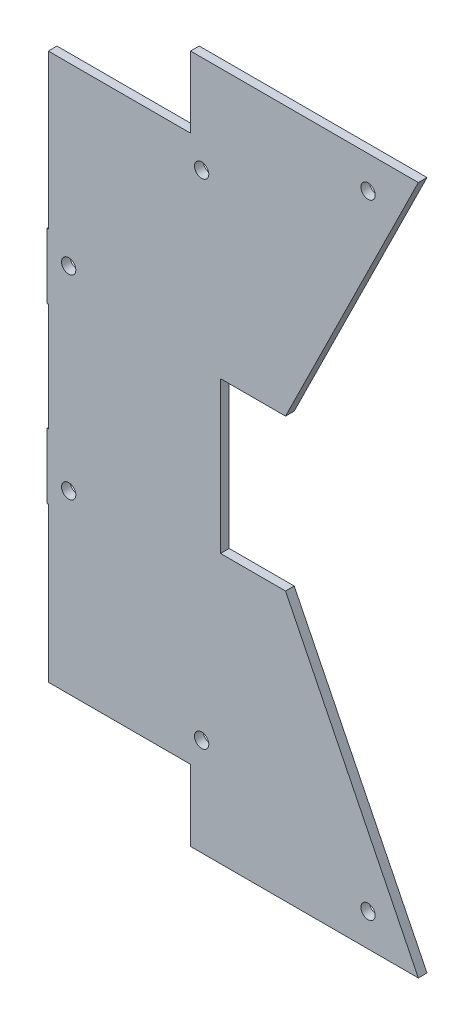
from build123d import *

# Parameters (mm, degrees)
SKETCH1_R           = 2.0955
BOSS_EXTRUDE1_DEPTH = 2.54


with BuildPart() as part:
    # Sketch1 → Boss-Extrude1 (new body)
    with BuildSketch(Plane.XY):
        Polygon((-2.930050059, -104.509781075), (-3.314938219, -104.509781075), (-3.314938219, -110.859781075), (-3.314938219, -123.559781075), (-2.930050059, -123.559781075), (-2.930050059, -168.708281075), (38.709428475, -168.708281075), (38.709428475, -189.536281075), (105.397061781, -189.536281075), (66.517436481, -110.859781075), (47.485061781, -110.859781075), (47.485061781, -104.509781075), (47.485061781, -72.886781075), (47.485061781, -66.536781075), (66.517436481, -66.536781075), (105.397061781, 12.139718925), (38.709428475, 12.139718925), (38.709428475, -8.688281075), (-2.930050059, -8.688281075), (-2.930050059, -53.836781075), (-3.314938219, -53.836781075), (-3.314938219, -66.536781075), (-3.314938219, -72.886781075), (-2.930050059, -72.886781075), align=None)
        with Locations((90.673911143, 2.614718925)):
            Circle(SKETCH1_R, mode=Mode.SUBTRACT)
        with Locations((41.95655448, -16.435281075)):
            Circle(SKETCH1_R, mode=Mode.SUBTRACT)
        with Locations((3.035061781, -60.186781075)):
            Circle(SKETCH1_R, mode=Mode.SUBTRACT)
        with Locations((3.035061781, -117.209781075)):
            Circle(SKETCH1_R, mode=Mode.SUBTRACT)
        with Locations((41.95655448, -160.961281075)):
            Circle(SKETCH1_R, mode=Mode.SUBTRACT)
        with Locations((90.673911143, -180.011281075)):
            Circle(SKETCH1_R, mode=Mode.SUBTRACT)
    extrude(amount=BOSS_EXTRUDE1_DEPTH)


solid = part.part
